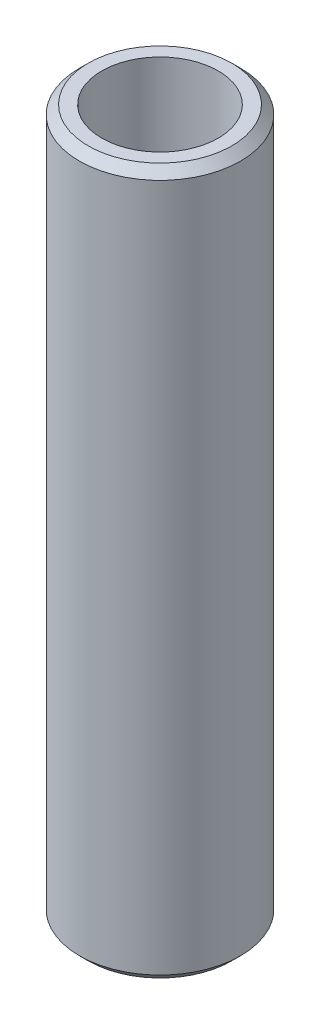
from build123d import *

# Parameters (mm, degrees)
SKETCH1_R           = 55
BOSS_EXTRUDE1_DEPTH = 481.983862891
SKETCH2_R           = 39.792786733
CUT_EXTRUDE1_DEPTH  = 489.219667862
CHAMFER1_SIZE       = 5.996013482


with BuildPart() as part:
    # Sketch1 → Boss-Extrude1 (new body)
    with BuildSketch(Plane(origin=(0, 0, 0), x_dir=(1, 0, 0), z_dir=(0, 1, 0))):
        Circle(SKETCH1_R)
    extrude(amount=BOSS_EXTRUDE1_DEPTH)

    # Sketch2 → Cut-Extrude1 (cut, through all)
    with BuildSketch(Plane(origin=(0, 0, 0), x_dir=(1, 0, 0), z_dir=(0, 1, 0))):
        Circle(SKETCH2_R)
    extrude(amount=CUT_EXTRUDE1_DEPTH, mode=Mode.SUBTRACT)

    # Chamfer1
    chamfer1_edges = [part.edges().sort_by_distance(p)[0] for p in [
        (-55, 481.983862891, 0),
        (-55, 0, 0),
    ]]
    chamfer(chamfer1_edges, length=CHAMFER1_SIZE)


solid = part.part
